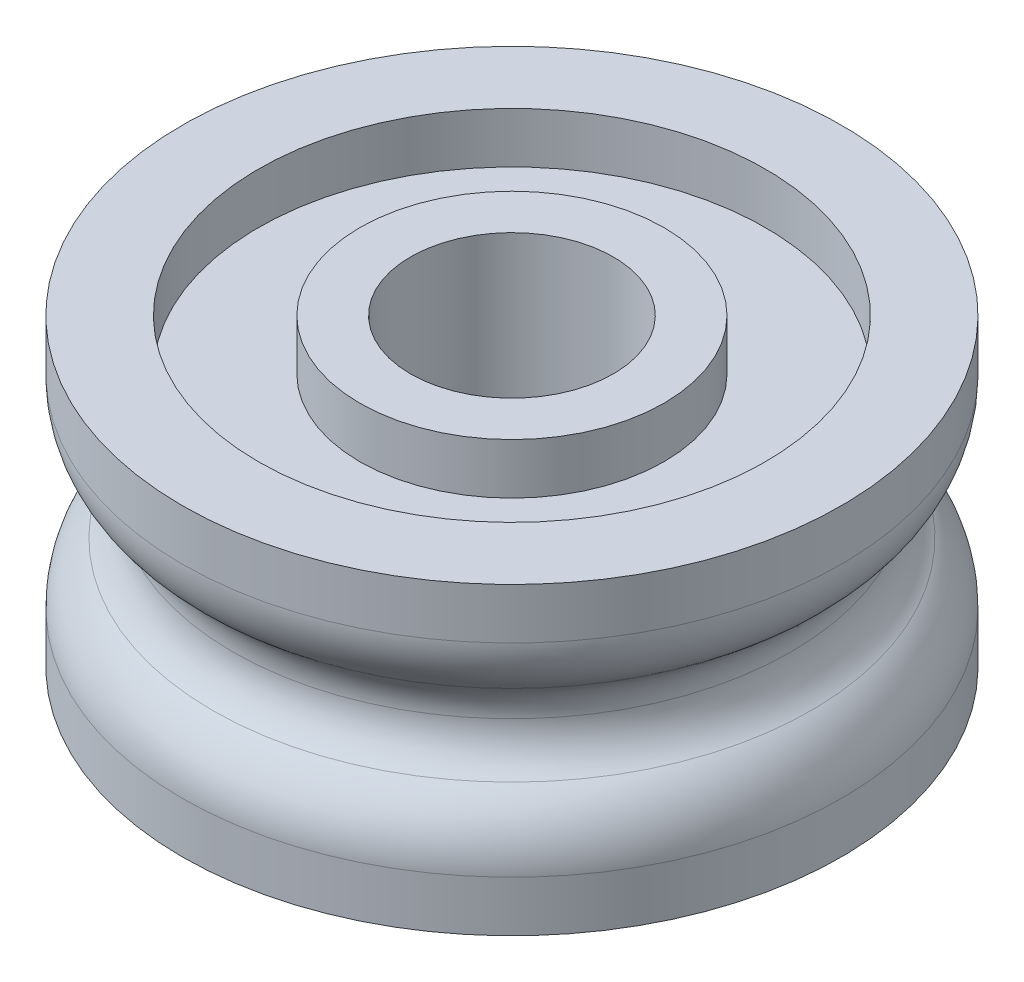
from build123d import *

# Parameters (mm, degrees)
SKETCH_1_R          = 6.5
SKETCH_1_R_2        = 2
EXTRUDE_1_DEPTH     = 6
SKETCH_2_R          = 5
SKETCH_2_R_2        = 3
CUT_EXTRUDE_1_DEPTH = 1
CUT_EXTRUDE_START   = -1
SKETCH_3_R          = 5
SKETCH_3_R_2        = 3
CUT_EXTRUDE_2_DEPTH = 1
SKETCH_4_W          = 1
SKETCH_4_H          = 2
FILLET_1_R          = 1
FILLET_2_R          = 1.5


with BuildPart() as part:
    # 草图1 → 凸台-拉伸1 (new body)
    with BuildSketch(Plane(origin=(0, 0, 0), x_dir=(1, 0, 0), z_dir=(0, 1, 0))):
        with Locations(Location((0, 0, 0), (0, 0, 270))):
            Circle(SKETCH_1_R)
        with Locations(Location((0, 0, 0), (0, 0, 270))):
            Circle(SKETCH_1_R_2, mode=Mode.SUBTRACT)
    extrude(amount=EXTRUDE_1_DEPTH)

    # 草图2 → 切除-拉伸1 (cut)
    with BuildSketch(Plane(origin=(0, 6, 0), x_dir=(1, 0, 0), z_dir=(0, 1, 0))):
        with Locations(Location((0, 0, 0), (0, 0, 270))):
            Circle(SKETCH_2_R)
        with Locations(Location((0, 0, 0), (0, 0, 270))):
            Circle(SKETCH_2_R_2, mode=Mode.SUBTRACT)
    extrude(amount=-CUT_EXTRUDE_1_DEPTH, mode=Mode.SUBTRACT)

    # 草图3 → 切除-拉伸2 (cut)
    with BuildSketch(Plane(origin=(0, 0, 0), x_dir=(-1, 0, 0), z_dir=(0, -1, 0)).offset(CUT_EXTRUDE_START)):
        with Locations(Location((0, 0, 0), (0, 0, 270))):
            Circle(SKETCH_3_R)
        with Locations(Location((0, 0, 0), (0, 0, 270))):
            Circle(SKETCH_3_R_2, mode=Mode.SUBTRACT)
    extrude(amount=CUT_EXTRUDE_2_DEPTH, mode=Mode.SUBTRACT)

    # 草图4 → 切除-旋转1 (revolve, cut)
    with BuildSketch(Plane.XY, mode=Mode.PRIVATE) as cut_revolve_1_sk:
        with Locations((6, 3)):
            Rectangle(SKETCH_4_W, SKETCH_4_H)
    revolve(cut_revolve_1_sk.sketch.rotate(Axis((0, 0, 0), (0, 1, 0)), 90), axis=Axis((0, 0, 0), (0, 1, 0)), mode=Mode.SUBTRACT)

    # 圆角1
    fillet_1_edges = [part.edges().sort_by_distance(p)[0] for p in [
        (0, 2, 5.5),
        (0, 4, 5.5),
    ]]
    fillet(fillet_1_edges, radius=FILLET_1_R - 0.0001)  # a hair under: the kernel refuses the full size

    # 圆角2
    fillet_2_edges = [part.edges().sort_by_distance(p)[0] for p in [
        (0, 4, -6.5),
        (0, 2, -6.5),
    ]]
    fillet(fillet_2_edges, radius=FILLET_2_R)


solid = part.part
